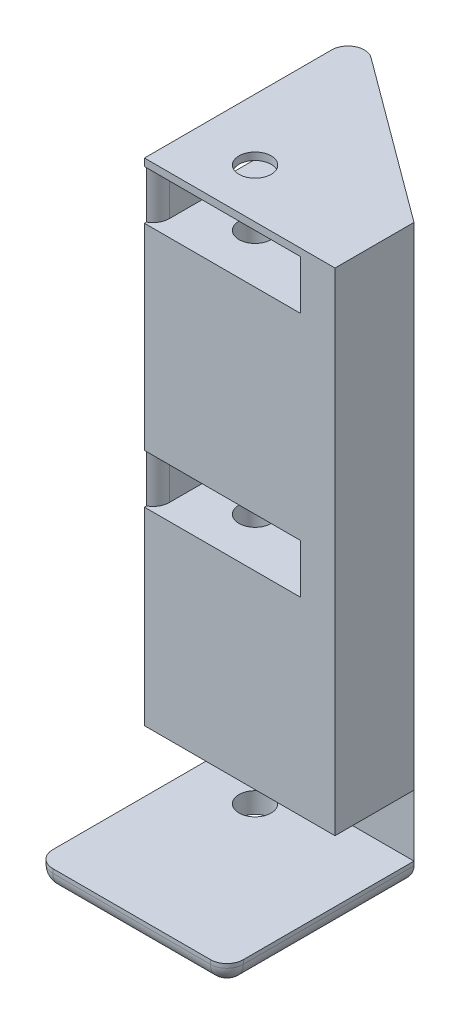
from build123d import *

# Parameters (mm, degrees)
SKETCH1_W               = 29.532117275
SKETCH1_H               = 16.294493356
BOSS_EXTRUDE1_DEPTH     = 6.35
BOSS_EXTRUDE2_DEPTH     = 82.55
SKETCH2_W               = 29.532117275
SKETCH2_H               = 16.294493356
CUT_EXTRUDE1_DEPTH      = 3.175
SKETCH4_W               = 29.532117275
SKETCH4_H               = 12.7
BOSS_EXTRUDE3_DEPTH     = 3.175
SKETCH7_W               = 36.710026843
SKETCH7_H               = 7.62
CUT_EXTRUDE4_DEPTH      = 13.589
SKETCH8_W               = 36.710026843
SKETCH8_H               = 7.62
CUT_EXTRUDE5_DEPTH      = 13.589
SKETCH9_W               = 29.532117275
SKETCH9_H               = 76.2
SKETCH9_W_2             = 22.877365929
SKETCH9_H_2             = 7.62
BOSS_EXTRUDE5_DEPTH     = 12.2428
CUT_EXTRUDE6_DEPTH      = 95.918198917
CUT_EXTRUDE6_DEPTH_BACK = 95.918198917
SKETCH10_R              = 2.4892
FILLET2_R               = 2.54
FILLET3_R               = 2.54


with BuildPart() as part:
    # Sketch1 → Boss-Extrude1 (new body)
    with BuildSketch(Plane(origin=(0, 0, 0), x_dir=(1, 0, 0), z_dir=(0, 1, 0))):
        Polygon((16.296436439, 0), (-13.235680836, 21.805506644), (-13.235680836, 0), align=None)
        with Locations((1.530377802, -8.147246678)):
            Rectangle(SKETCH1_W, SKETCH1_H)
    extrude(amount=BOSS_EXTRUDE1_DEPTH)

    # Sketch1<3> → Boss-Extrude2 (add)
    with BuildSketch(Plane(origin=(0, 0, 0), x_dir=(1, 0, 0), z_dir=(0, 1, 0))):
        Polygon((16.296436439, 0), (-13.235680836, 21.805506644), (-13.235680836, 0), align=None)
    extrude(amount=-BOSS_EXTRUDE2_DEPTH)

    # Sketch2 → Cut-Extrude1 (cut)
    with BuildSketch(Plane(origin=(0, 0, 0), x_dir=(-1, 0, 0), z_dir=(0, -1, 0))):
        with Locations((-1.530377802, -8.147246678)):
            Rectangle(SKETCH2_W, SKETCH2_H)
    extrude(amount=-CUT_EXTRUDE1_DEPTH, mode=Mode.SUBTRACT)

    # Sketch4 → Boss-Extrude3 (add)
    with BuildSketch(Plane(origin=(0, 6.35, 0), x_dir=(1, 0, 0), z_dir=(0, 1, 0))):
        with Locations((1.530377802, -22.644493356)):
            Rectangle(SKETCH4_W, SKETCH4_H)
    extrude(amount=-BOSS_EXTRUDE3_DEPTH)

    # Sketch7 → Cut-Extrude4 (cut)
    with BuildSketch(Plane(origin=(3.863909533, 0, -5.233055638), x_dir=(-0.804470053980136, 0, -0.5939932089251503), z_dir=(0.5939932089251503, 0, -0.804470053980136))):
        with Locations((5.24501832, -77.597)):
            Rectangle(SKETCH7_W, SKETCH7_H)
    extrude(amount=-CUT_EXTRUDE4_DEPTH, mode=Mode.SUBTRACT)

    # Sketch8 → Cut-Extrude5 (cut)
    with BuildSketch(Plane(origin=(3.863909533, 0, -5.233055638), x_dir=(-0.804470053980136, 0, -0.5939932089251503), z_dir=(0.5939932089251503, 0, -0.804470053980136))):
        with Locations((5.24501832, -39.497)):
            Rectangle(SKETCH8_W, SKETCH8_H)
    extrude(amount=-CUT_EXTRUDE5_DEPTH, mode=Mode.SUBTRACT)

    # Sketch9 → Boss-Extrude5 (add)
    with BuildSketch(Plane.XY):
        with Locations((1.530377802, -44.45)):
            Rectangle(SKETCH9_W, SKETCH9_H)
        with Locations((-0.487425481, -77.597)):
            Rectangle(SKETCH9_W_2, SKETCH9_H_2, mode=Mode.SUBTRACT)
        with Locations((-0.487425481, -39.497)):
            Rectangle(SKETCH9_W_2, SKETCH9_H_2, mode=Mode.SUBTRACT)
    extrude(amount=BOSS_EXTRUDE5_DEPTH)

    # Sketch10 → Cut-Extrude6 (cut, two sides: drawn at the far end of the back side and taken through both)
    with BuildSketch(Plane(origin=(0, -82.55, 0), x_dir=(-1, 0, 0), z_dir=(0, -1, 0)).offset(-CUT_EXTRUDE6_DEPTH_BACK)):
        with Locations(Location((3.710680836, -4.6228, 0), (0, 0, 270))):
            Circle(SKETCH10_R)
    extrude(amount=CUT_EXTRUDE6_DEPTH + CUT_EXTRUDE6_DEPTH_BACK, mode=Mode.SUBTRACT)

    # Fillet2
    # the kernel refuses this fillet: 2.54 mm, written as the material it takes off along each edge
    with BuildSketch(Plane(origin=(-13.235680836, -95.13201822, -21.805506644), x_dir=(0.8044700539801357, 0, 0.5939932089251506), z_dir=(0, 1, 0))) as fillet2_piece_1:
        with BuildLine():
            CenterArc((FILLET2_R * 1.98142019214, -FILLET2_R), FILLET2_R, 90, 126.440893479)
            Line((FILLET2_R * 1.17695013816, -FILLET2_R * 1.59399320893), (0, 0))
            Line((0, 0), (FILLET2_R * 1.98142019214, 0))
        make_face()
    extrude(amount=114.06403644, mode=Mode.SUBTRACT)
    with BuildSketch(Plane(origin=(-11.926108446, -81.407, 0), x_dir=(-0.8044700539801358, 0, -0.5939932089251506), z_dir=(0, 1, 0))) as fillet2_piece_2:
        with BuildLine():
            CenterArc((FILLET2_R * 0.504688507753, FILLET2_R), FILLET2_R, 216.440893479, 53.559106521)
            Line((-FILLET2_R * 0.299781546228, FILLET2_R * 0.406006791075), (0, 0))
            Line((0, 0), (FILLET2_R * 0.504688507753, 0))
        make_face()
    extrude(amount=7.62, mode=Mode.SUBTRACT)
    with BuildSketch(Plane(origin=(-11.926108446, -81.407, 12.2428), x_dir=(-1, 0, 0), z_dir=(0, 1, 0)), Plane(origin=(-11.926108446, -43.307, 12.2428), x_dir=(-1, 0, 0), z_dir=(0, 1, 0))) as fillet2_piece_3:
        with BuildLine():
            CenterArc((FILLET2_R, -FILLET2_R), FILLET2_R, 90, 90)
            Line((0, -FILLET2_R), (0, 0))
            Line((0, 0), (FILLET2_R, 0))
        make_face()
    extrude(amount=7.62, mode=Mode.SUBTRACT)
    with BuildSketch(Plane(origin=(-11.926108446, -35.687, 0), x_dir=(-0.8044700539801356, 0, -0.5939932089251507), z_dir=(0, -1, 0))) as fillet2_piece_4:
        with BuildLine():
            CenterArc((FILLET2_R * 0.504688507753, -FILLET2_R), FILLET2_R, 90, 53.559106521)
            Line((-FILLET2_R * 0.299781546228, -FILLET2_R * 0.406006791075), (0, 0))
            Line((0, 0), (FILLET2_R * 0.504688507753, 0))
        make_face()
    extrude(amount=7.62, mode=Mode.SUBTRACT)
    with BuildSketch(Plane(origin=(-13.235680836, 12.7, 28.994493356), x_dir=(0, 0, -1), z_dir=(0, -1, 0))) as fillet2_piece_5:
        with BuildLine():
            CenterArc((FILLET2_R, FILLET2_R), FILLET2_R, 180, 90)
            Line((0, FILLET2_R), (0, 0))
            Line((0, 0), (FILLET2_R, 0))
        make_face()
    extrude(amount=15.875, mode=Mode.SUBTRACT)
    with BuildSketch(Plane(origin=(16.296436439, 12.7, 28.994493356), x_dir=(0, 0, -1), z_dir=(0, -1, 0))) as fillet2_piece_6:
        with BuildLine():
            CenterArc((FILLET2_R, -FILLET2_R), FILLET2_R, 90, 90)
            Line((0, -FILLET2_R), (0, 0))
            Line((0, 0), (FILLET2_R, 0))
        make_face()
    extrude(amount=15.875, mode=Mode.SUBTRACT)

    # Fillet3
    fillet3_edges = [part.edges().sort_by_distance(p)[0] for p in [
        (-13.235680836, 6.35, 4.840897),
        (1.530377801, 6.35, 28.994493356),
        (16.296436439, 6.35, 13.227246678),
        (15.552487663, 6.35, 28.25054458),
        (-12.491732061, 6.35, 28.25054458),
        (-11.840100649, 6.35, -19.04027588),
        (3.554749177, 6.35, -9.408026646),
    ]]
    fillet(fillet3_edges, radius=FILLET3_R)


with BuildPart() as body_2:
    # Mirror1: mirrored copy
    add(part.part.mirror(Plane.ZX.offset(6.35)))


solid = body_2.part
